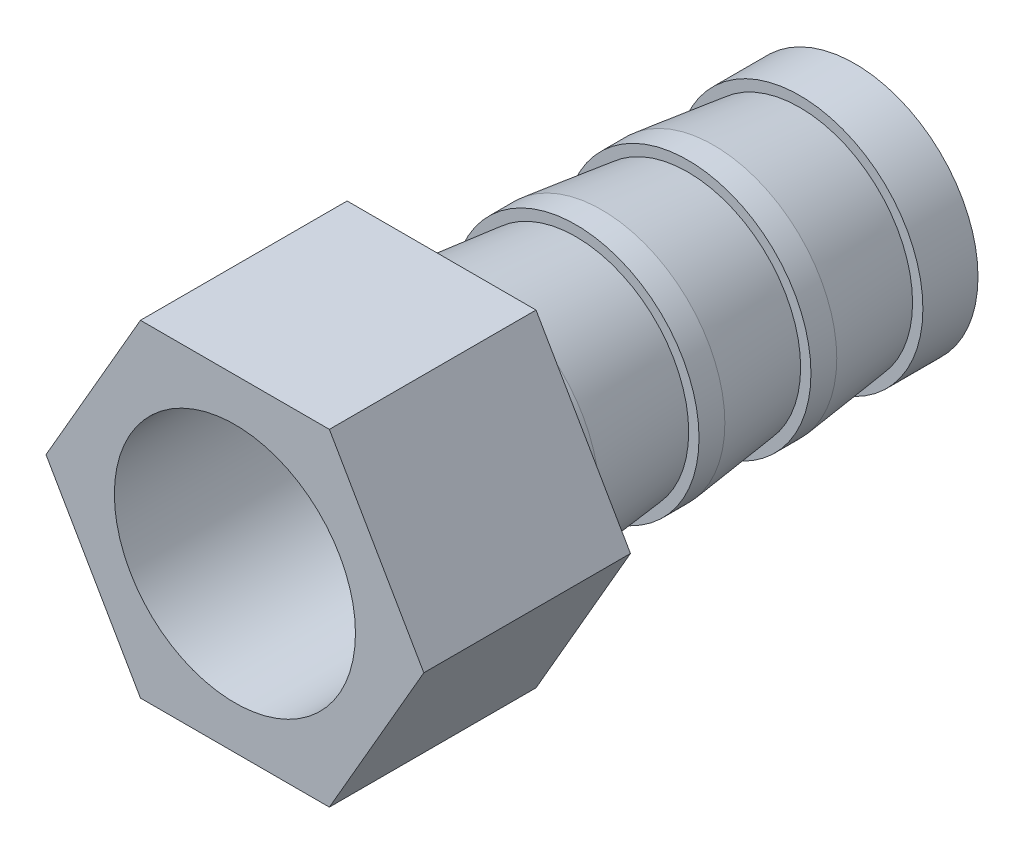
from build123d import *

# Parameters (mm, degrees)
SKETCH_1_R      = 7
EXTRUDE_1_DEPTH = 12


with BuildPart() as part:
    # 草图1 → 凸台-拉伸1 (new body)
    with BuildSketch(Plane.XY):
        Polygon((5.484827557, 9.5), (-5.484827557, 9.5), (-10.969655115, 0), (-5.484827557, -9.5), (5.484827557, -9.5), (10.969655115, 0), align=None)
        Circle(SKETCH_1_R, mode=Mode.SUBTRACT)
    extrude(amount=EXTRUDE_1_DEPTH)

    # 草图2 → 旋转1 (revolve)
    with BuildSketch(Plane(origin=(0, 0, 0), x_dir=(1, 0, 0), z_dir=(0, 1, 0))):
        Polygon((-7.15, 0), (-7.15, 2), (-6.55, 7.8), (-7.15, 7.8), (-7.15, 9.3), (-6.55, 14.3), (-7.15, 14.3), (-7.15, 15.8), (-6.55, 20.8), (-7.15, 20.8), (-7.15, 24), (-6, 24), (-6, 0), align=None)
    revolve(axis=Axis((0, 0, 0), (0, 0, -1)))


solid = part.part
